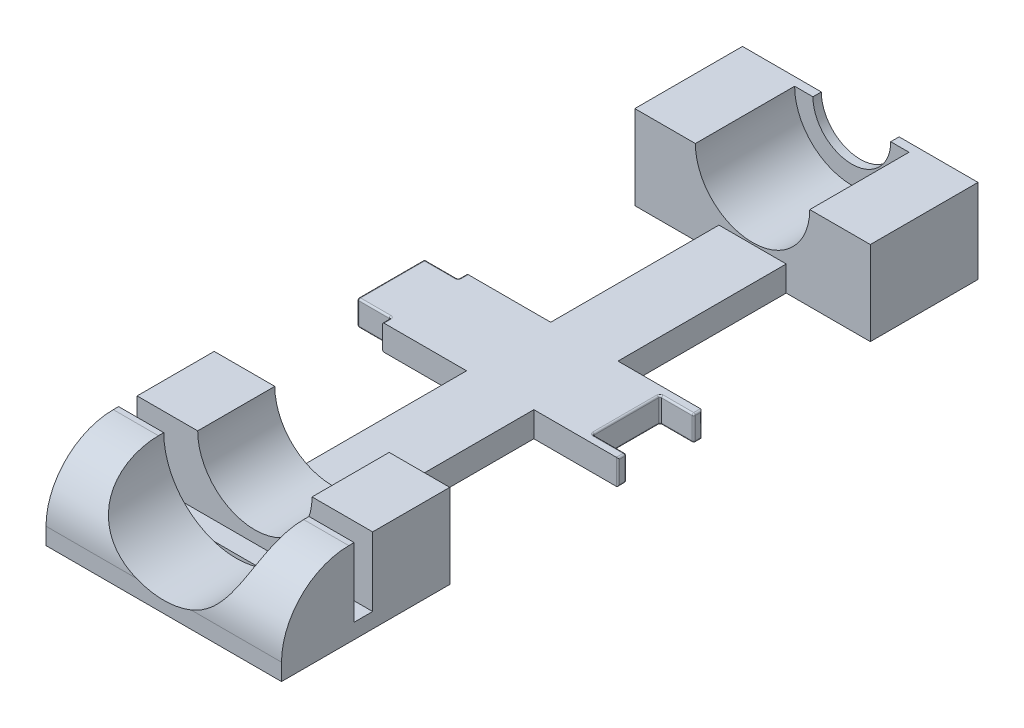
from build123d import *

# Parameters (mm, degrees)
SKETCH1_W                   = 28
SKETCH1_H                   = 90
BOSS_EXTRUDE1_DEPTH         = 10
SKETCH4_W                   = 6.8
SKETCH4_H                   = 71
SKETCH5_W                   = 28
SKETCH5_H                   = 2.2
FLANGE_SLOT_DEPTH           = 8.2
SKETCH6_W                   = 8.632931683
SKETCH6_H                   = 8.632931683
SKETCH3_W                   = 4.625
SKETCH3_H                   = 10.2
CUT_EXTRUDE4_DEPTH          = 49.176757882
CUT_EXTRUDE4_DEPTH_BACK     = 49.176757882
SKETCH17_W                  = 38.089842412
SKETCH17_H                  = 14.4
SKETCH18_W                  = 28
SKETCH18_H                  = 50
SYRINGE_BAY_DEPTH           = 7
SYRINGE_PLUNGER_LEFT_R      = 8
SYRINGE_START               = -15
SYRINGE_PLUNGER_RIGHT_DEPTH = 23.632931783
SKETCH19_W                  = 10
SKETCH19_H                  = 20
CUT_EXTRUDE5_DEPTH          = 10
SKETCH24_W                  = 8
SKETCH24_H                  = 3
BOSS_EXTRUDE3_DEPTH         = 4
SKETCH25_W                  = 8
SKETCH25_H                  = 3
CUT_EXTRUDE6_DEPTH          = 4
FILLET1_R                   = 0.2
FILLET2_R                   = 0.2


with BuildPart() as part:
    # Sketch1 → Boss-Extrude1 (new body)
    with BuildSketch(Plane(origin=(0, 0, 0), x_dir=(1, 0, 0), z_dir=(0, 1, 0))):
        Rectangle(SKETCH1_W, SKETCH1_H)
    extrude(amount=BOSS_EXTRUDE1_DEPTH)

    # Sketch4 → Syringe Body slot (revolve, cut)
    with BuildSketch(Plane(origin=(0, 10, 0), x_dir=(1, 0, 0), z_dir=(0, 1, 0))):
        with Locations((-3.4, 1.3)):
            Rectangle(SKETCH4_W, SKETCH4_H)
    revolve(axis=Axis((0, 10, -36.8), (0, 0, 1)), mode=Mode.SUBTRACT)

    # Sketch5 → Flange Slot (cut)
    with BuildSketch(Plane(origin=(0, 10, 0), x_dir=(1, 0, 0), z_dir=(0, 1, 0))):
        with Locations((0, -35.267068317)):
            Rectangle(SKETCH5_W, SKETCH5_H)
    extrude(amount=-FLANGE_SLOT_DEPTH, mode=Mode.SUBTRACT)

    # Sketch6 → Plunger Slot (revolve, cut)
    with BuildSketch(Plane(origin=(0, 10, 0), x_dir=(1, 0, 0), z_dir=(0, 1, 0))):
        with Locations((-4.316465842, -40.683534159)):
            Rectangle(SKETCH6_W, SKETCH6_H)
    revolve(axis=Axis((0, 10, 45), (0, 0, -1)), mode=Mode.SUBTRACT)

    # Sketch3 → Barrell Slot (revolve, cut)
    with BuildSketch(Plane(origin=(0, 10, 0), x_dir=(1, 0, 0), z_dir=(0, 1, 0))):
        with Locations((-2.3125, 39.9)):
            Rectangle(SKETCH3_W, SKETCH3_H)
    revolve(axis=Axis((0, 10, -45), (0, 0, 1)), mode=Mode.SUBTRACT)

    # Sketch17 → Cut-Extrude4 (cut, two sides: drawn at the far end of the back side and taken through both)
    with BuildSketch(Plane(origin=(0, 10, 0), x_dir=(1, 0, 0), z_dir=(0, 1, 0)).offset(-CUT_EXTRUDE4_DEPTH_BACK)):
        with Locations((0, 45)):
            Rectangle(SKETCH17_W, SKETCH17_H)
    extrude(amount=CUT_EXTRUDE4_DEPTH + CUT_EXTRUDE4_DEPTH_BACK, mode=Mode.SUBTRACT)

    # Sketch18 → Syringe Bay (cut)
    with BuildSketch(Plane(origin=(0, 10, 0), x_dir=(1, 0, 0), z_dir=(0, 1, 0))):
        Rectangle(SKETCH18_W, SKETCH18_H)
    extrude(amount=-SYRINGE_BAY_DEPTH, mode=Mode.SUBTRACT)

    # Syringe plunger left
    syringe_plunger_left_edges = [part.edges().sort_by_distance(p)[0] for p in [
        (11.316465842, 10, 45),
    ]]
    fillet(syringe_plunger_left_edges, radius=SYRINGE_PLUNGER_LEFT_R)

    # Syringe plunger right: read off the stored shape, not the designer's step
    # Syringe plunger right outline → Syringe plunger right (cut)
    with BuildSketch(Plane.YZ.offset(SYRINGE_START)):
        with BuildLine():
            ThreePointArc((2, 45), (7.656854249, 42.656854249), (10, 37))
            Line((10, 37), (10, 45))
            Line((10, 45), (2, 45))
        make_face()
    extrude(amount=SYRINGE_PLUNGER_RIGHT_DEPTH, mode=Mode.SUBTRACT)

    # Sketch19 → Cut-Extrude5 (cut)
    with BuildSketch(Plane(origin=(0, 3, 0), x_dir=(1, 0, 0), z_dir=(0, 1, 0))):
        with Locations((-9, 15)):
            Rectangle(SKETCH19_W, SKETCH19_H)
        with Locations((-9, -15)):
            Rectangle(SKETCH19_W, SKETCH19_H)
        with Locations((9, -15)):
            Rectangle(SKETCH19_W, SKETCH19_H)
        with Locations((9, 15)):
            Rectangle(SKETCH19_W, SKETCH19_H)
    extrude(amount=-CUT_EXTRUDE5_DEPTH, mode=Mode.SUBTRACT)

    # Sketch24 → Boss-Extrude3 (add)
    with BuildSketch(Plane.ZY.offset(14)):
        with Locations((0, 1.5)):
            Rectangle(SKETCH24_W, SKETCH24_H)
    extrude(amount=BOSS_EXTRUDE3_DEPTH)

    # Sketch25 → Cut-Extrude6 (cut)
    with BuildSketch(Plane(origin=(14, 0, 0), x_dir=(0, 0, -1), z_dir=(1, 0, 0))):
        with Locations((0, 1.5)):
            Rectangle(SKETCH25_W, SKETCH25_H)
    extrude(amount=-CUT_EXTRUDE6_DEPTH, mode=Mode.SUBTRACT)

    # Fillet1
    fillet1_edges = [part.edges().sort_by_distance(p)[0] for p in [
        (14, 0, 4.5),
        (14, 3, 4.5),
        (14, 1.5, -5),
        (14, 1.5, 5),
        (14, 0, -4.5),
        (14, 3, -4.5),
        (10, 1.5, -4),
        (12, 3, -4),
        (10, 0, 0),
        (12, 0, -4),
        (10, 1.5, 4),
        (12, 0, 4),
        (10, 3, 0),
        (12, 3, 4),
        (14, 1.5, -4),
        (14, 1.5, 4),
    ]]
    fillet(fillet1_edges, radius=FILLET1_R)

    # Fillet2
    fillet2_edges = [part.edges().sort_by_distance(p)[0] for p in [
        (-14, 0, -4.5),
        (-14, 3, -4.5),
        (-14, 3, 4.5),
        (-14, 0, 4.5),
        (-14, 1.5, 4),
        (-16, 0, 4),
        (-16, 3, 4),
        (-14, 1.5, -4),
        (-16, 3, -4),
        (-16, 0, -4),
        (-18, 1.5, 4),
        (-18, 3, 0),
        (-18, 1.5, -4),
        (-18, 0, 0),
    ]]
    fillet(fillet2_edges, radius=FILLET2_R)


solid = part.part
